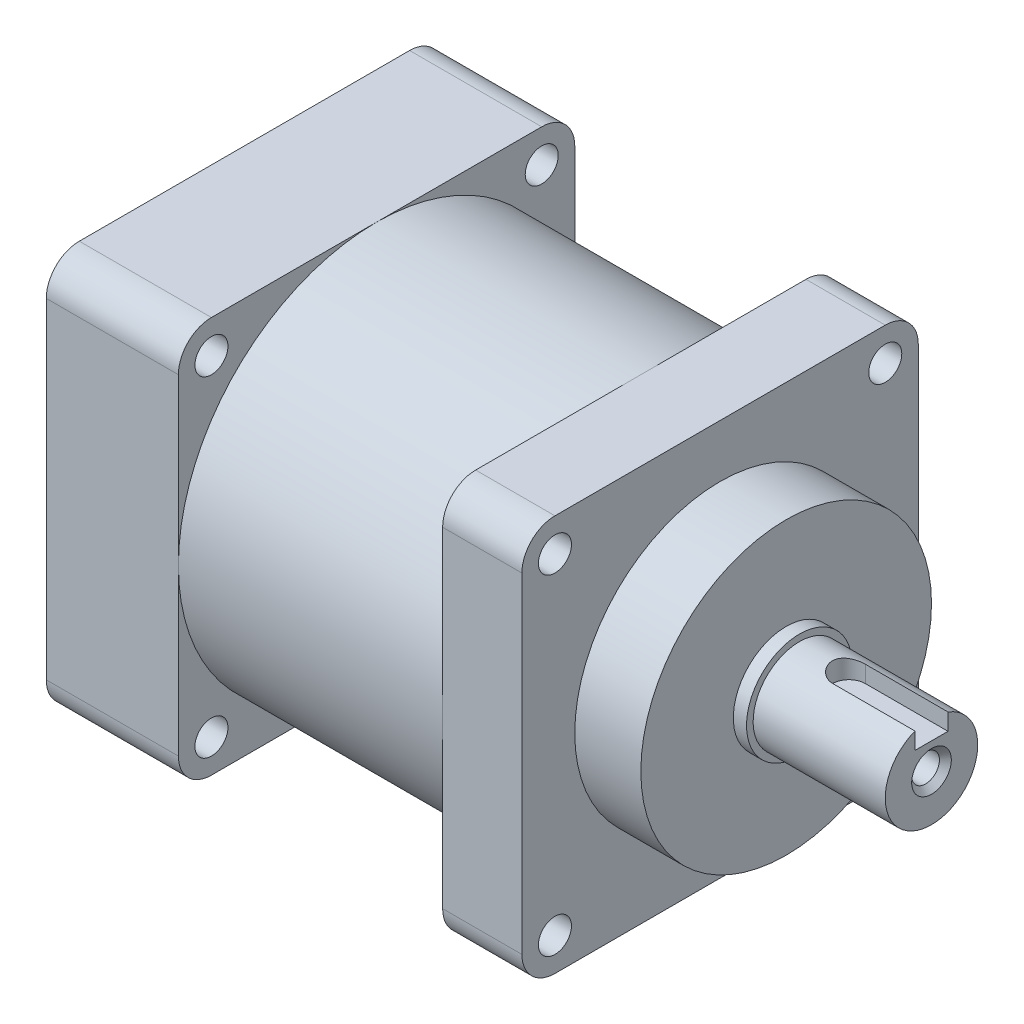
from build123d import *

# Parameters (mm, degrees)
SKETCH_1_W           = 60
SKETCH_1_H           = 60
EXTRUDE_1_DEPTH      = 20
SKETCH_2_R           = 30
EXTRUDE_2_DEPTH      = 40
SKETCH_3_W           = 60
SKETCH_3_H           = 60
EXTRUDE_3_DEPTH      = 12
SKETCH_4_R           = 22
EXTRUDE_4_DEPTH      = 10
SKETCH_5_R           = 7
EXTRUDE_5_DEPTH      = 22
SKETCH_6_R           = 2.5
CUT_EXTRUDE_1_DEPTH  = 135.223693885
SKETCH_7_R           = 25
CUT_EXTRUDE_2_DEPTH  = 5
SKETCH_8_R           = 7
CUT_EXTRUDE_3_DEPTH  = 25
CUT_EXTRUDE_START    = -15
CUT_EXTRUDE_5_DEPTH  = 15
FILLET_1_R           = 2.5
SKETCH_11_R          = 8
EXTRUDE_6_DEPTH      = 2
M5X0_751_D           = 4.2
M5X0_751_DEPTH       = 14
M5X0_751_CSINK_D     = 6
M5X0_751_CSINK_ANGLE = 90
M5X0_751_TIP         = 1.2618073
FILLET_2_R           = 5
SKETCH_15_W          = 5
SKETCH_15_H          = 2.461651585
CUT_EXTRUDE_6_DEPTH  = 24
FILLET_3_R           = 2.5


with BuildPart() as part:
    # Эскиз1 → Бобышка-Вытянуть1 (new body)
    with BuildSketch(Plane(origin=(0, 0, 0), x_dir=(0, 0, -1), z_dir=(1, 0, 0))):
        with Locations((30, 30)):
            Rectangle(SKETCH_1_W, SKETCH_1_H)
    extrude(amount=EXTRUDE_1_DEPTH)

    # Эскиз2 → Бобышка-Вытянуть2 (add)
    with BuildSketch(Plane(origin=(20, 0, 0), x_dir=(0, 0, -1), z_dir=(1, 0, 0))):
        with Locations((30, 30)):
            Circle(SKETCH_2_R)
    extrude(amount=EXTRUDE_2_DEPTH)

    # Эскиз3 → Бобышка-Вытянуть3 (add)
    with BuildSketch(Plane(origin=(60, 0, 0), x_dir=(0, 0, -1), z_dir=(1, 0, 0))):
        with Locations((30, 30)):
            Rectangle(SKETCH_3_W, SKETCH_3_H)
    extrude(amount=EXTRUDE_3_DEPTH)

    # Эскиз4 → Бобышка-Вытянуть4 (add)
    with BuildSketch(Plane(origin=(72, 0, 0), x_dir=(0, 0, -1), z_dir=(1, 0, 0))):
        with Locations((30, 30)):
            Circle(SKETCH_4_R)
    extrude(amount=EXTRUDE_4_DEPTH)

    # Эскиз5 → Бобышка-Вытянуть5 (add)
    with BuildSketch(Plane(origin=(82, 0, 0), x_dir=(0, 0, -1), z_dir=(1, 0, 0))):
        with Locations((30, 30)):
            Circle(SKETCH_5_R)
    extrude(amount=EXTRUDE_5_DEPTH)

    # Эскиз6 → Вырез-Вытянуть1 (cut, through all)
    with BuildSketch(Plane.ZY):
        with Locations(Location((-55, 55, 0), (0, 0, 180))):
            Circle(SKETCH_6_R)
        with Locations(Location((-5, 55, 0), (0, 0, 180))):
            Circle(SKETCH_6_R)
        with Locations(Location((-5, 5, 0), (0, 0, 180))):
            Circle(SKETCH_6_R)
        with Locations(Location((-55, 5, 0), (0, 0, 180))):
            Circle(SKETCH_6_R)
    extrude(amount=-CUT_EXTRUDE_1_DEPTH, mode=Mode.SUBTRACT)

    # Эскиз7 → Вырез-Вытянуть2 (cut)
    with BuildSketch(Plane.ZY):
        with Locations((-30, 30)):
            Circle(SKETCH_7_R)
    extrude(amount=-CUT_EXTRUDE_2_DEPTH, mode=Mode.SUBTRACT)

    # Эскиз8 → Вырез-Вытянуть3 (cut)
    with BuildSketch(Plane.ZY.offset(-5)):
        with Locations(Location((-30, 30, 0), (0, 0, 180))):
            Circle(SKETCH_8_R)
    extrude(amount=-CUT_EXTRUDE_3_DEPTH, mode=Mode.SUBTRACT)

    # Эскиз10 → Вырез-Вытянуть5 (cut)
    with BuildSketch(Plane(origin=(104, 0, 0), x_dir=(0, 0, -1), z_dir=(1, 0, 0)).offset(CUT_EXTRUDE_START)):
        with BuildLine():
            Line((27.5, 34), (32.5, 34))
            Line((32.5, 34), (32.5, 36.538348415))
            ThreePointArc((32.5, 36.538348415), (30, 37), (27.5, 36.538348415))
            Line((27.5, 36.538348415), (27.5, 34))
        make_face()
    extrude(amount=CUT_EXTRUDE_5_DEPTH, mode=Mode.SUBTRACT)

    # Скругление1
    fillet_1_edges = [part.edges().sort_by_distance(p)[0] for p in [
        (89, 35.269174208, -27.5),
        (89, 35.269174208, -32.5),
    ]]
    fillet(fillet_1_edges, radius=FILLET_1_R - 0.0001)  # a hair under: the kernel refuses the full size

    # Эскиз11 → Бобышка-Вытянуть6 (add)
    with BuildSketch(Plane(origin=(82, 0, 0), x_dir=(0, 0, -1), z_dir=(1, 0, 0))):
        with Locations((30, 30)):
            Circle(SKETCH_11_R)
    extrude(amount=EXTRUDE_6_DEPTH)

    # Отверстие обработанное метчиком M5x0.751
    with Locations(Plane(origin=(104, 0, 0), x_dir=(0, 0, -1), z_dir=(1, 0, 0))):
        with Locations((30, 30)):
            CounterSinkHole(M5X0_751_D / 2, M5X0_751_CSINK_D / 2, depth=M5X0_751_DEPTH, counter_sink_angle=M5X0_751_CSINK_ANGLE)
            with Locations((0, 0, -(M5X0_751_DEPTH + M5X0_751_TIP / 2))):  # 118° drill point
                Cone(0, M5X0_751_D / 2, M5X0_751_TIP, mode=Mode.SUBTRACT)

    # Скругление2
    fillet_2_edges = [part.edges().sort_by_distance(p)[0] for p in [
        (66, 60, 0),
        (66, 0, 0),
        (66, 0, -60),
        (66, 60, -60),
        (10, 60, 0),
        (10, 60, -60),
        (10, 0, -60),
        (10, 0, 0),
    ]]
    fillet(fillet_2_edges, radius=FILLET_2_R)

    # Эскиз15 → Вырез-Вытянуть6 (cut)
    with BuildSketch(Plane.ZY.offset(-5)):
        with Locations((-30, 37.769174208)):
            Rectangle(SKETCH_15_W, SKETCH_15_H)
    extrude(amount=-CUT_EXTRUDE_6_DEPTH, mode=Mode.SUBTRACT)

    # Скругление3
    fillet_3_edges = [part.edges().sort_by_distance(p)[0] for p in [
        (29, 37.769174208, -32.5),
        (29, 37.769174208, -27.5),
    ]]
    fillet(fillet_3_edges, radius=FILLET_3_R - 0.0001)  # a hair under: the kernel refuses the full size


solid = part.part
